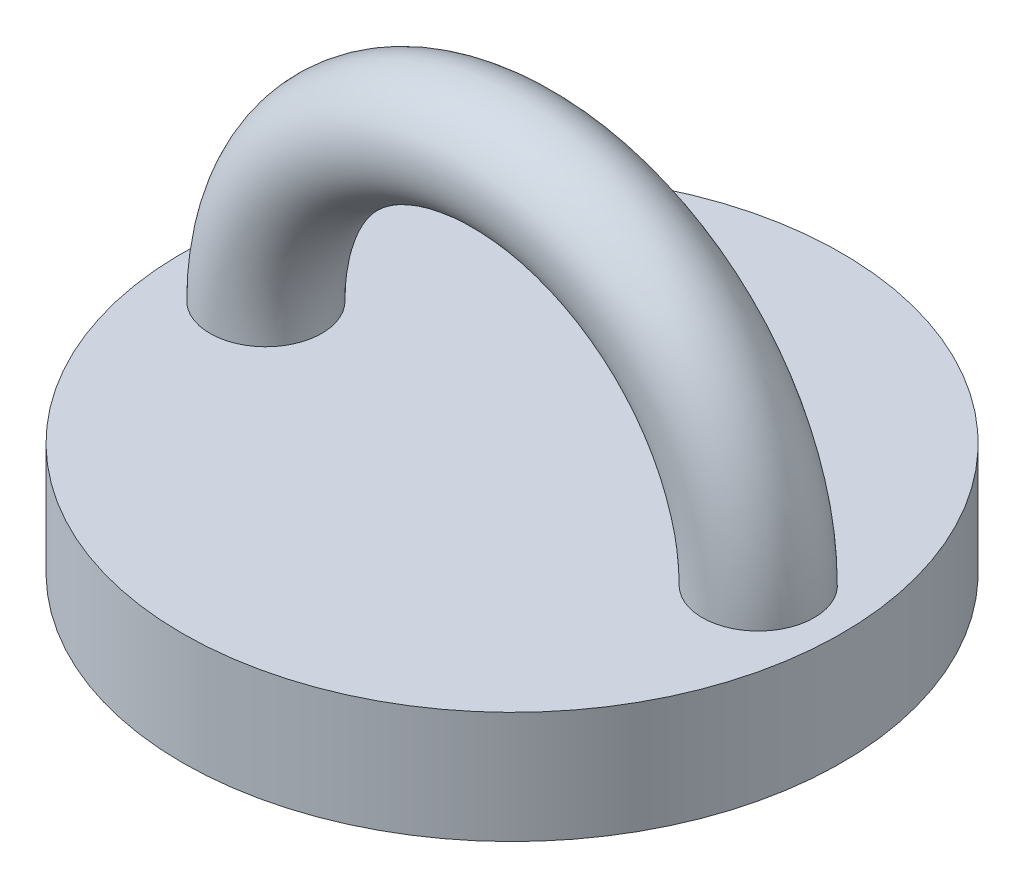
from build123d import *

# Parameters (mm, degrees)
SKETCH1_R           = 29.45
BOSS_EXTRUDE1_DEPTH = 10
SKETCH2_R           = 5
REVOLVE3_ANGLE      = 180


with BuildPart() as part:
    # Sketch1 → Boss-Extrude1 (new body)
    with BuildSketch(Plane(origin=(0, 0, 0), x_dir=(1, 0, 0), z_dir=(0, 1, 0))):
        Circle(SKETCH1_R)
    extrude(amount=BOSS_EXTRUDE1_DEPTH)

    # Sketch2 → Revolve3 (revolve)
    with BuildSketch(Plane(origin=(0, 10, 0), x_dir=(1, 0, 0), z_dir=(0, 1, 0))):
        with Locations((-22, 0)):
            Circle(SKETCH2_R)
    revolve(axis=Axis((0, 10, 39.385958338), (0, 0, -1)), revolution_arc=REVOLVE3_ANGLE)


solid = part.part
